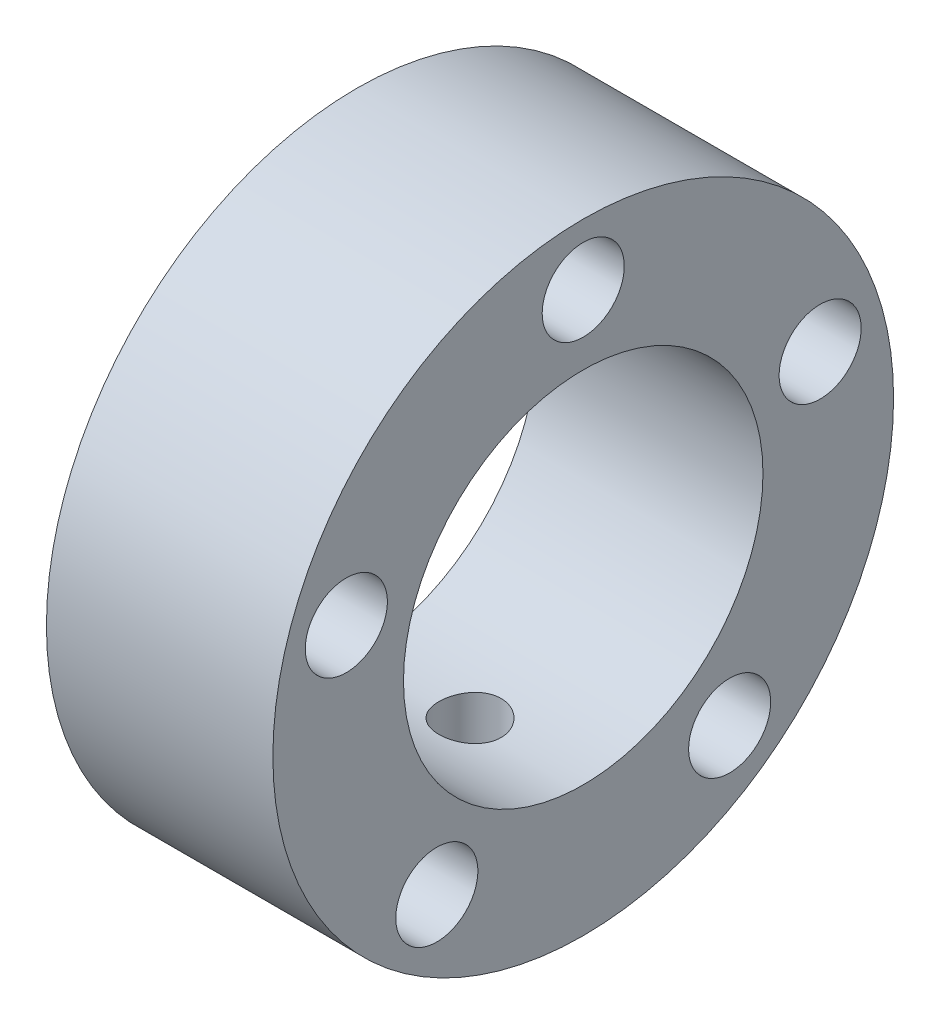
from build123d import *

# Parameters (mm, degrees)
SKETCH1_R           = 13.924461334
SKETCH1_R_2         = 8.0645
BOSS_EXTRUDE1_DEPTH = 10.16
SKETCH2_R           = 1.8415
CUT_EXTRUDE1_DEPTH  = 23.158674304
SKETCH3_R           = 1.397
CUT_EXTRUDE2_DEPTH  = 23.158674304


with BuildPart() as part:
    # Sketch1 → Boss-Extrude1 (new body)
    with BuildSketch(Plane(origin=(0, 0, 0), x_dir=(0, 0, -1), z_dir=(1, 0, 0))):
        Circle(SKETCH1_R)
        Circle(SKETCH1_R_2, mode=Mode.SUBTRACT)
    extrude(amount=BOSS_EXTRUDE1_DEPTH)

    # Sketch2 → Cut-Extrude1 (cut, through all)
    with BuildSketch(Plane.ZY):
        with Locations((0, 11.176)):
            Circle(SKETCH2_R)
        with Locations((10.629007626, 3.453573929)):
            Circle(SKETCH2_R)
        with Locations((6.56908798, -9.041573929)):
            Circle(SKETCH2_R)
        with Locations((-6.56908798, -9.041573929)):
            Circle(SKETCH2_R)
        with Locations((-10.629007626, 3.453573929)):
            Circle(SKETCH2_R)
    extrude(amount=-CUT_EXTRUDE1_DEPTH, mode=Mode.SUBTRACT)

    # Sketch3 → Cut-Extrude2 (cut, through all)
    with BuildSketch(Plane(origin=(0, 0, 0), x_dir=(1, 0, 0), z_dir=(0, 1, 0))):
        with Locations((5.08, 0)):
            Circle(SKETCH3_R)
    extrude(amount=-CUT_EXTRUDE2_DEPTH, mode=Mode.SUBTRACT)


solid = part.part
